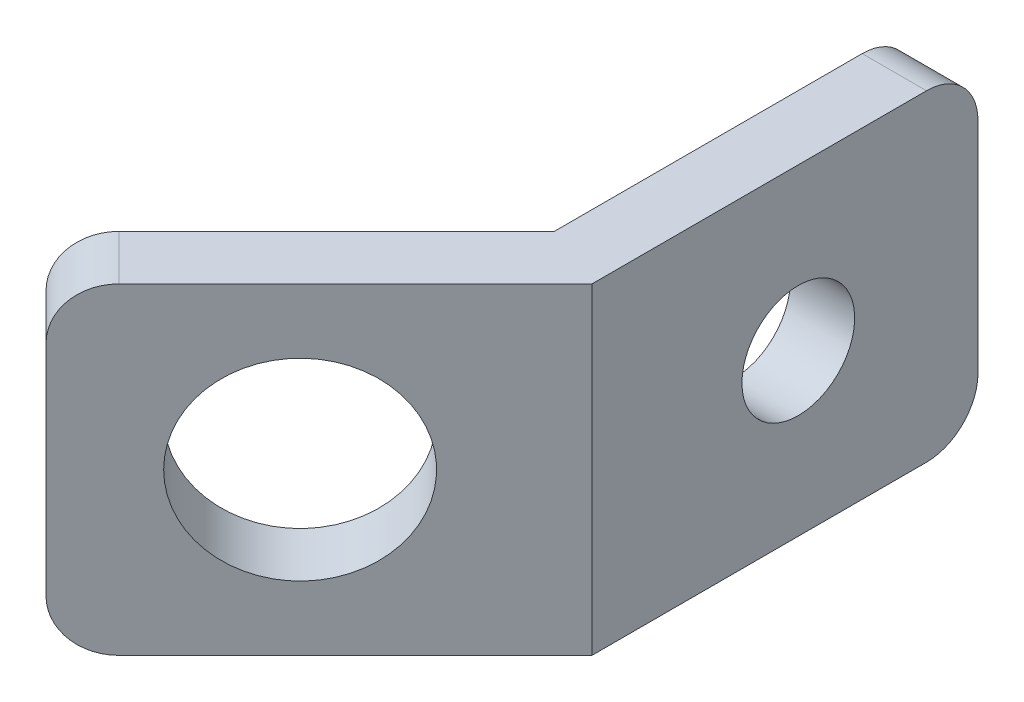
from build123d import *

# Parameters (mm, degrees)
BOSS_EXTRUDE1_DEPTH = 15.875
SKETCH3_R           = 2.7813
CUT_EXTRUDE1_DEPTH  = 28.788144349
SKETCH4_R           = 4.7625
CUT_EXTRUDE2_DEPTH  = 27.755798399
FILLET1_R           = 2.54


with BuildPart() as part:
    # Sketch1 → Boss-Extrude1 (new body)
    with BuildSketch(Plane(origin=(0, 0, 0), x_dir=(1, 0, 0), z_dir=(0, 1, 0))):
        Polygon((0, 0), (0, 19.05), (-3.175, 19.05), (-3.175, 1.315128061), (-15.715448212, -11.225320151), (-13.470384182, -13.470384182), align=None)
    extrude(amount=BOSS_EXTRUDE1_DEPTH)

    # Sketch3 → Cut-Extrude1 (cut, through all)
    with BuildSketch(Plane.ZY.offset(3.175)):
        with Locations((-10.18256403, 7.9375)):
            Circle(SKETCH3_R)
    extrude(amount=-CUT_EXTRUDE1_DEPTH, mode=Mode.SUBTRACT)

    # Sketch4 → Cut-Extrude2 (cut, through all)
    with BuildSketch(Plane(origin=(-2.24506403, 0, -2.24506403), x_dir=(-0.7071067811865487, 0, 0.7071067811865465), z_dir=(-0.7071067811865465, 0, -0.7071067811865487))):
        with Locations((10.18256403, 7.9375)):
            Circle(SKETCH4_R)
    extrude(amount=-CUT_EXTRUDE2_DEPTH, mode=Mode.SUBTRACT)

    # Fillet1
    fillet1_edges = [part.edges().sort_by_distance(p)[0] for p in [
        (-1.5875, 15.875, -19.05),
        (-1.5875, 0, -19.05),
        (-14.592916197, 0, 12.347852166),
        (-14.592916197, 15.875, 12.347852166),
    ]]
    fillet(fillet1_edges, radius=FILLET1_R)


solid = part.part
